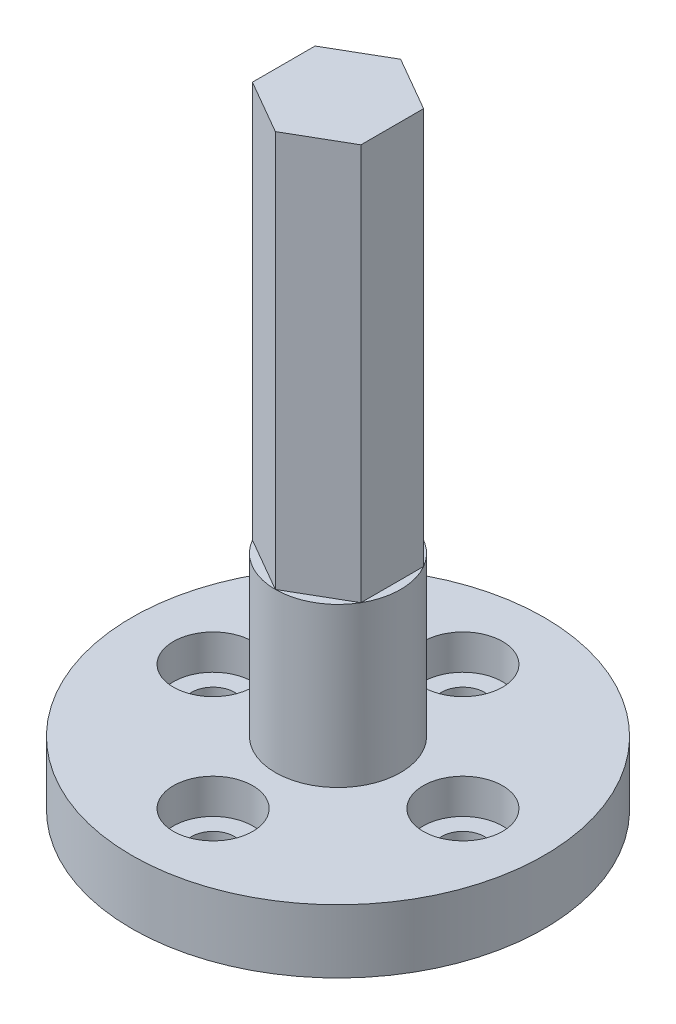
from build123d import *

# Parameters (mm, degrees)
CROQUIS3_R              = 13
SALIENTE_EXTRUIR1_DEPTH = 4
CROQUIS4_R              = 3.95
SALIENTE_EXTRUIR2_DEPTH = 35
CROQUIS12_OUTSIDE_W     = 38.72
CROQUIS12_OUTSIDE_H     = 38.72
CORTAR_EXTRUIR7_DEPTH   = 25
CROQUIS13_R             = 1.35
CORTAR_EXTRUIR8_DEPTH   = 10
CROQUIS14_R             = 2.5
CORTAR_EXTRUIR9_DEPTH   = 2.2


with BuildPart() as part:
    # Croquis3 → Saliente-Extruir1 (new body)
    with BuildSketch(Plane(origin=(0, 0, 0), x_dir=(1, 0, 0), z_dir=(0, 1, 0))):
        Circle(CROQUIS3_R)
    extrude(amount=SALIENTE_EXTRUIR1_DEPTH)

    # Croquis4 → Saliente-Extruir2 (add)
    with BuildSketch(Plane(origin=(0, 4, 0), x_dir=(1, 0, 0), z_dir=(0, 1, 0))):
        Circle(CROQUIS4_R)
    extrude(amount=SALIENTE_EXTRUIR2_DEPTH)

    # Croquis12 outside → Cortar-Extruir7 (cut)
    with BuildSketch(Plane(origin=(0, 39, 0), x_dir=(1, 0, 0), z_dir=(0, 1, 0))):
        Rectangle(CROQUIS12_OUTSIDE_W, CROQUIS12_OUTSIDE_H)
        Polygon((0, 3.95), (-3.420800345, 1.975), (-3.420800345, -1.975), (0, -3.95), (3.420800345, -1.975), (3.420800345, 1.975), align=None, mode=Mode.SUBTRACT)
    extrude(amount=-CORTAR_EXTRUIR7_DEPTH, mode=Mode.SUBTRACT)

    # Croquis13 → Cortar-Extruir8 (cut)
    with BuildSketch(Plane.XZ):
        with Locations((0, 7.875)):
            Circle(CROQUIS13_R)
        with Locations((7.875, 0)):
            Circle(CROQUIS13_R)
        with Locations((0, -7.875)):
            Circle(CROQUIS13_R)
        with Locations((-7.875, 0)):
            Circle(CROQUIS13_R)
    extrude(amount=-CORTAR_EXTRUIR8_DEPTH, mode=Mode.SUBTRACT)

    # Croquis14 → Cortar-Extruir9 (cut)
    with BuildSketch(Plane(origin=(0, 4, 0), x_dir=(1, 0, 0), z_dir=(0, 1, 0))):
        with Locations((0, 7.875)):
            Circle(CROQUIS14_R)
        with Locations((7.875, 0)):
            Circle(CROQUIS14_R)
        with Locations((0, -7.875)):
            Circle(CROQUIS14_R)
        with Locations((-7.875, 0)):
            Circle(CROQUIS14_R)
    extrude(amount=-CORTAR_EXTRUIR9_DEPTH, mode=Mode.SUBTRACT)


solid = part.part
